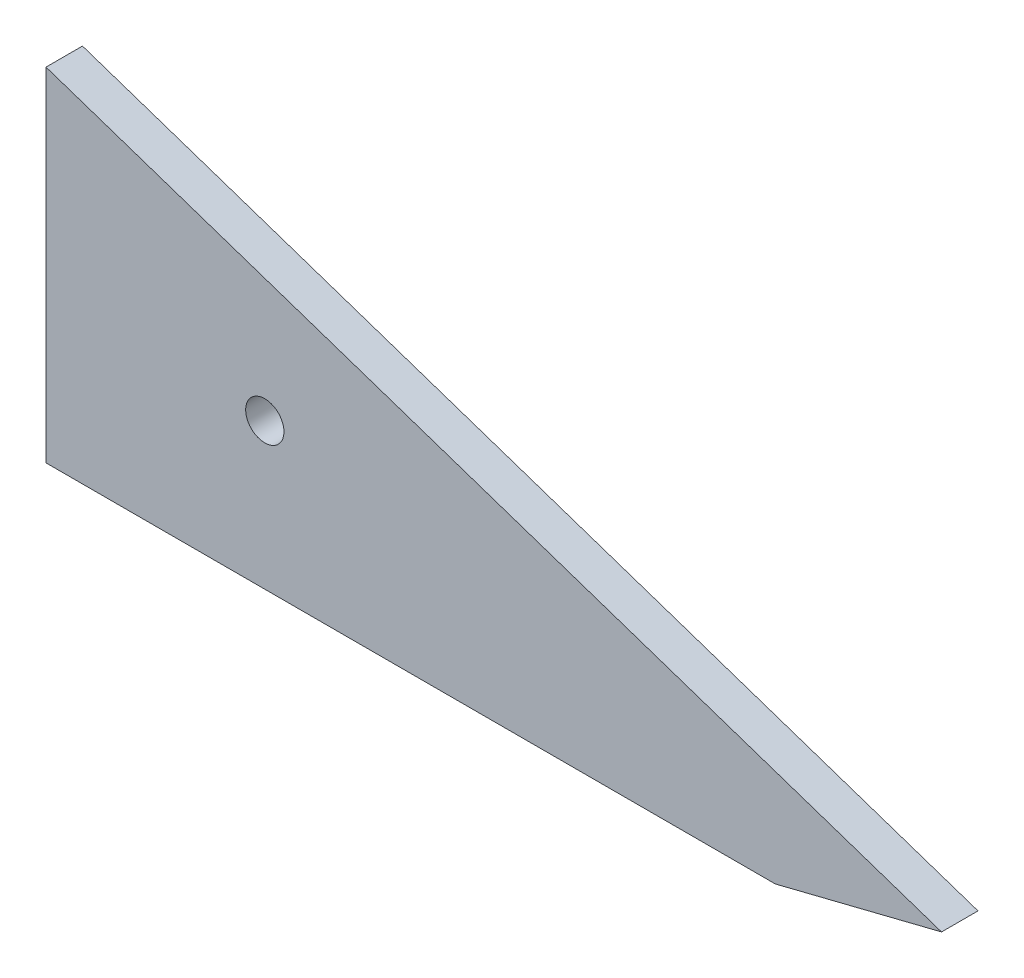
from build123d import *

# Parameters (mm, degrees)
BOSS_EXTRUDE1_DEPTH        = 10
M12X1_5_TAPPED_HOLE2_D     = 10.5
M12X1_5_TAPPED_HOLE2_DEPTH = 28.5
M12X1_5_TAPPED_HOLE2_TIP   = 3.15451825


with BuildPart() as part:
    # Sketch1 → Boss-Extrude1 (new body)
    with BuildSketch(Plane.XY):
        Polygon((0, 0), (200, 0), (220, 5), (245.581395349, 11.395348837), (220, 20), (0, 94), align=None)
    extrude(amount=BOSS_EXTRUDE1_DEPTH)

    # M12x1.5 Tapped Hole2
    with Locations(Plane(origin=(60, 40, 10), x_dir=(1, 0, 0), z_dir=(0, 0, 1))):
        with Locations((0, 0)):
            Hole(M12X1_5_TAPPED_HOLE2_D / 2, depth=M12X1_5_TAPPED_HOLE2_DEPTH)
            with Locations((0, 0, -(M12X1_5_TAPPED_HOLE2_DEPTH + M12X1_5_TAPPED_HOLE2_TIP / 2))):  # 118° drill point
                Cone(0, M12X1_5_TAPPED_HOLE2_D / 2, M12X1_5_TAPPED_HOLE2_TIP, mode=Mode.SUBTRACT)


solid = part.part
